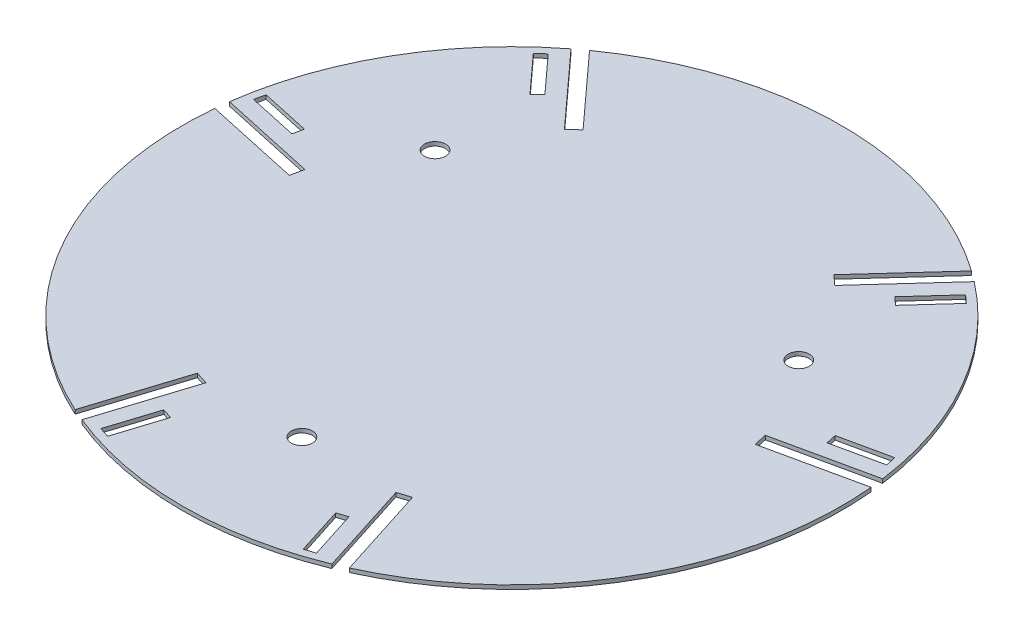
from build123d import *

# Parameters (mm, degrees)
SKETCH2_R           = 125
BOSS_EXTRUDE1_DEPTH = 1.5
SKETCH3_W           = 3
SKETCH3_H           = 19
CUT_EXTRUDE1_DEPTH  = 177.783059143
SKETCH4_R           = 4
CUT_EXTRUDE2_DEPTH  = 177.783059143
CUT_EXTRUDE4_DEPTH  = 177.783059143
CIRPATTERN1_COUNT   = 3


with BuildPart() as part:
    # Sketch2 → Boss-Extrude1 (new body)
    with BuildSketch(Plane(origin=(0, 0, 0), x_dir=(1, 0, 0), z_dir=(0, 1, 0))):
        Circle(SKETCH2_R)
    extrude(amount=BOSS_EXTRUDE1_DEPTH)

    # Sketch3 → Cut-Extrude1 (cut, through all)
    with BuildSketch(Plane(origin=(0, 1.5, 0), x_dir=(1, 0, 0), z_dir=(0, 1, 0))):
        with Locations((-268.691654721, -368.173324402)):
            Rectangle(SKETCH3_W, SKETCH3_H)
        Polygon((31.312, -98.125219266), (35.122688127, -96.909219266), (40.898688127, -115.009987868), (37.088, -116.225987868), align=None)
        Polygon((-37.088, -116.225987868), (-31.312, -98.125219266), (-35.122688127, -96.909219266), (-40.898688127, -115.009987868), align=None)
        Polygon((-82.110658074, 90.23214411), (-69.322932636, 76.179597076), (-66.364501682, 78.8717498), (-79.15222712, 92.924296834), align=None)
        Polygon((-100.634932636, 21.94562219), (-101.487189809, 18.037469466), (-120.050915246, 22.085691035), (-119.198658074, 25.993843759), align=None)
        Polygon((119.198658074, 25.993843759), (100.634932636, 21.94562219), (101.487189809, 18.037469466), (120.050915246, 22.085691035), align=None)
        Polygon((69.322932636, 76.179597076), (66.364501682, 78.8717498), (79.15222712, 92.924296834), (82.110658074, 90.23214411), align=None)
    extrude(amount=-CUT_EXTRUDE1_DEPTH, mode=Mode.SUBTRACT)

    # Sketch4 → Cut-Extrude2 (cut, through all)
    with BuildSketch(Plane(origin=(0, 1.5, 0), x_dir=(1, 0, 0), z_dir=(0, 1, 0))):
        with Locations((0, -79.639104061)):
            Circle(SKETCH4_R)
        with Locations((-68.969487251, 39.81955203)):
            Circle(SKETCH4_R)
        with Locations((68.969487251, 39.81955203)):
            Circle(SKETCH4_R)
    extrude(amount=-CUT_EXTRUDE2_DEPTH, mode=Mode.SUBTRACT)

    # Sketch5 → Cut-Extrude4 (cut, through all)
    with BuildSketch(Plane(origin=(0, 1.5, 0), x_dir=(1, 0, 0), z_dir=(0, 1, 0))):
        Polygon((-54.658376335, -138.393113266), (-59.421736493, -136.873113266), (-40.787332932, -78.476813592), (-36.023972773, -79.996813592), align=None)
        Polygon((59.421736493, -136.873113266), (40.787332932, -78.476813592), (36.023972773, -79.996813592), (54.658376335, -138.393113266), align=None)
    cut_extrude4 = extrude(amount=-CUT_EXTRUDE4_DEPTH, mode=Mode.SUBTRACT)

    # CirPattern1: Cut-Extrude4 ×3 about axis
    cirpattern1_axis = Axis((0, 1.5, 0), (0, 1, 0))
    for i in range(1, CIRPATTERN1_COUNT):
        add(cut_extrude4.rotate(cirpattern1_axis, i * 360 / CIRPATTERN1_COUNT), mode=Mode.SUBTRACT)


solid = part.part
